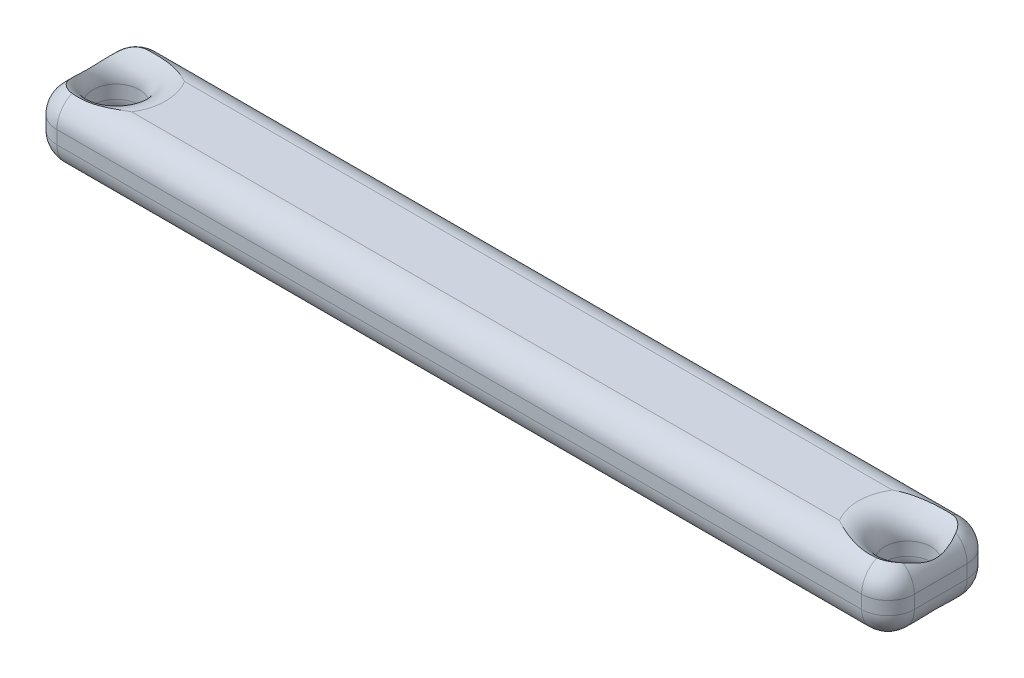
from build123d import *

# Parameters (mm, degrees)
SKETCH1_W           = 65
SKETCH1_H           = 5
BOSS_EXTRUDE1_DEPTH = 8
SKETCH2_R           = 1.75
CUT_EXTRUDE1_DEPTH  = 37.504037204
FILLET1_R           = 2


with BuildPart() as part:
    # Sketch1 → Boss-Extrude1 (new body)
    with BuildSketch(Plane.XY):
        with Locations((2.763929619, 0)):
            Rectangle(SKETCH1_W, SKETCH1_H)
    extrude(amount=-BOSS_EXTRUDE1_DEPTH)

    # Sketch2 → Cut-Extrude1 (cut, through all)
    with BuildSketch(Plane(origin=(0, 2.5, 0), x_dir=(1, 0, 0), z_dir=(0, 1, 0))):
        with Locations(Location((32.763929619, 4, 0), (0, 0, 180))):
            Circle(SKETCH2_R)
        with Locations((-27.236070381, 4)):
            Circle(SKETCH2_R)
    extrude(amount=-CUT_EXTRUDE1_DEPTH, mode=Mode.SUBTRACT)

    # Fillet1
    # the kernel refuses this fillet: 2 mm, written as the material it takes off along each edge
    with BuildSketch(Plane(origin=(33.263929619, 0.5, -6), x_dir=(0, 0, -1), z_dir=(0, 1, 0))) as fillet1_piece_1_section:
        Polygon((0, 0), (FILLET1_R, 0), (FILLET1_R, -FILLET1_R), (0, -FILLET1_R), align=None)
    fillet1_piece_1 = extrude(amount=FILLET1_R, mode=Mode.PRIVATE)
    fillet1_piece_1 = fillet1_piece_1 - Plane(origin=(33.263929619, 0.5, -6), x_dir=(-0.7071067811865475, 0, 0.7071067811865475), z_dir=(0, 1, 0)) * Sphere(FILLET1_R, mode=Mode.PRIVATE)
    add(fillet1_piece_1, mode=Mode.SUBTRACT)
    with BuildSketch(Plane(origin=(33.263929619, -0.5, -6), x_dir=(1, 0, 0), z_dir=(0, 0, -1))) as fillet1_piece_2_section:
        Polygon((0, 0), (FILLET1_R, 0), (FILLET1_R, FILLET1_R), (0, FILLET1_R), align=None)
    fillet1_piece_2 = extrude(amount=FILLET1_R, mode=Mode.PRIVATE)
    fillet1_piece_2 = fillet1_piece_2 - Plane(origin=(33.263929619, -0.5, -6), x_dir=(-0.7071067811865475, 0.7071067811865475, 0), z_dir=(0, 0, -1)) * Sphere(FILLET1_R, mode=Mode.PRIVATE)
    add(fillet1_piece_2, mode=Mode.SUBTRACT)
    with BuildSketch(Plane(origin=(-27.736070381, 0.5, -6), x_dir=(-1, 0, 0), z_dir=(0, 1, 0))) as fillet1_piece_3_section:
        Polygon((0, 0), (FILLET1_R, 0), (FILLET1_R, -FILLET1_R), (0, -FILLET1_R), align=None)
    fillet1_piece_3 = extrude(amount=FILLET1_R, mode=Mode.PRIVATE)
    fillet1_piece_3 = fillet1_piece_3 - Plane(origin=(-27.736070381, 0.5, -6), x_dir=(0.7071067811865475, 0, 0.7071067811865475), z_dir=(0, 1, 0)) * Sphere(FILLET1_R, mode=Mode.PRIVATE)
    add(fillet1_piece_3, mode=Mode.SUBTRACT)
    with BuildSketch(Plane(origin=(-27.736070381, -0.5, -6), x_dir=(0, 0, -1), z_dir=(-1, 0, 0))) as fillet1_piece_4_section:
        Polygon((0, 0), (FILLET1_R, 0), (FILLET1_R, FILLET1_R), (0, FILLET1_R), align=None)
    fillet1_piece_4 = extrude(amount=FILLET1_R, mode=Mode.PRIVATE)
    fillet1_piece_4 = fillet1_piece_4 - Plane(origin=(-27.736070381, -0.5, -6), x_dir=(0, 0.7071067811865475, 0.7071067811865475), z_dir=(-1, 0, 0)) * Sphere(FILLET1_R, mode=Mode.PRIVATE)
    add(fillet1_piece_4, mode=Mode.SUBTRACT)
    with BuildSketch(Plane(origin=(-27.736070381, 0.5, -2), x_dir=(-1, 0, 0), z_dir=(0, 1, 0))) as fillet1_piece_5_section:
        Polygon((0, 0), (FILLET1_R, 0), (FILLET1_R, FILLET1_R), (0, FILLET1_R), align=None)
    fillet1_piece_5 = extrude(amount=FILLET1_R, mode=Mode.PRIVATE)
    fillet1_piece_5 = fillet1_piece_5 - Plane(origin=(-27.736070381, 0.5, -2), x_dir=(0.7071067811865475, 0, -0.7071067811865475), z_dir=(0, 1, 0)) * Sphere(FILLET1_R, mode=Mode.PRIVATE)
    add(fillet1_piece_5, mode=Mode.SUBTRACT)
    with BuildSketch(Plane(origin=(33.263929619, 0.5, -2), x_dir=(0, 0, 1), z_dir=(0, 1, 0))) as fillet1_piece_6_section:
        Polygon((0, 0), (FILLET1_R, 0), (FILLET1_R, FILLET1_R), (0, FILLET1_R), align=None)
    fillet1_piece_6 = extrude(amount=FILLET1_R, mode=Mode.PRIVATE)
    fillet1_piece_6 = fillet1_piece_6 - Plane(origin=(33.263929619, 0.5, -2), x_dir=(-0.7071067811865475, 0, -0.7071067811865475), z_dir=(0, 1, 0)) * Sphere(FILLET1_R, mode=Mode.PRIVATE)
    add(fillet1_piece_6, mode=Mode.SUBTRACT)
    with BuildSketch(Plane(origin=(33.263929619, -0.5, -2), x_dir=(1, 0, 0), z_dir=(0, 0, 1))) as fillet1_piece_7_section:
        Polygon((0, 0), (FILLET1_R, 0), (FILLET1_R, -FILLET1_R), (0, -FILLET1_R), align=None)
    fillet1_piece_7 = extrude(amount=FILLET1_R, mode=Mode.PRIVATE)
    fillet1_piece_7 = fillet1_piece_7 - Plane(origin=(33.263929619, -0.5, -2), x_dir=(-0.7071067811865475, 0.7071067811865475, 0), z_dir=(0, 0, 1)) * Sphere(FILLET1_R, mode=Mode.PRIVATE)
    add(fillet1_piece_7, mode=Mode.SUBTRACT)
    with BuildSketch(Plane(origin=(-27.736070381, -0.5, -2), x_dir=(0, 0, 1), z_dir=(-1, 0, 0))) as fillet1_piece_8_section:
        Polygon((0, 0), (FILLET1_R, 0), (FILLET1_R, -FILLET1_R), (0, -FILLET1_R), align=None)
    fillet1_piece_8 = extrude(amount=FILLET1_R, mode=Mode.PRIVATE)
    fillet1_piece_8 = fillet1_piece_8 - Plane(origin=(-27.736070381, -0.5, -2), x_dir=(0, 0.7071067811865475, -0.7071067811865475), z_dir=(-1, 0, 0)) * Sphere(FILLET1_R, mode=Mode.PRIVATE)
    add(fillet1_piece_8, mode=Mode.SUBTRACT)
    with BuildSketch(Plane(origin=(35.263929619, 0.5, -8), x_dir=(-1, 0, 0), z_dir=(0, -1, 0)), Plane(origin=(-29.736070381, -0.5, 0), x_dir=(0, 0, -1), z_dir=(0, 1, 0))) as fillet1_piece_9:
        with BuildLine():
            CenterArc((FILLET1_R, -FILLET1_R), FILLET1_R, 90, 90)
            Line((0, -FILLET1_R), (0, 0))
            Line((0, 0), (FILLET1_R, 0))
        make_face()
    extrude(amount=1, mode=Mode.SUBTRACT)
    with BuildSketch(Plane(origin=(-27.736070381, 2.5, -8), x_dir=(0, 0, 1), z_dir=(1, 0, 0)), Plane(origin=(33.263929619, -2.5, 0), x_dir=(0, 1, 0), z_dir=(-1, 0, 0))) as fillet1_piece_10:
        with BuildLine():
            CenterArc((FILLET1_R, FILLET1_R), FILLET1_R, 180, 90)
            Line((0, FILLET1_R), (0, 0))
            Line((0, 0), (FILLET1_R, 0))
        make_face()
    extrude(amount=61, mode=Mode.SUBTRACT)
    with BuildSketch(Plane(origin=(-27.236070381, 2.5, -4), x_dir=(1, 0, 0), z_dir=(0, 0, 1))) as fillet1_piece_11:
        with BuildLine():
            CenterArc((1.75 + FILLET1_R, -FILLET1_R), FILLET1_R, 90, 90)
            Line((1.75, -FILLET1_R), (1.75, 0))
            Line((1.75, 0), (1.75 + FILLET1_R, 0))
        make_face()
    revolve(axis=Axis((-27.236070381, 2.5, -4), (0, 1, 0)), mode=Mode.SUBTRACT)
    with BuildSketch(Plane(origin=(-27.236070381, -2.5, -4), x_dir=(1, 0, 0), z_dir=(0, 0, 1))) as fillet1_piece_12:
        with BuildLine():
            CenterArc((1.75 + FILLET1_R, FILLET1_R), FILLET1_R, 180, 90)
            Line((1.75 + FILLET1_R, 0), (1.75, 0))
            Line((1.75, 0), (1.75, FILLET1_R))
        make_face()
    revolve(axis=Axis((-27.236070381, -2.5, -4), (0, 1, 0)), mode=Mode.SUBTRACT)
    with BuildSketch(Plane(origin=(32.763929619, -2.5, -4), x_dir=(-1, 0, 0), z_dir=(0, 0, -1))) as fillet1_piece_13:
        with BuildLine():
            CenterArc((1.75 + FILLET1_R, FILLET1_R), FILLET1_R, 180, 90)
            Line((1.75 + FILLET1_R, 0), (1.75, 0))
            Line((1.75, 0), (1.75, FILLET1_R))
        make_face()
    revolve(axis=Axis((32.763929619, -2.5, -4), (0, 1, 0)), mode=Mode.SUBTRACT)
    with BuildSketch(Plane(origin=(32.763929619, 2.5, -4), x_dir=(-1, 0, 0), z_dir=(0, 0, -1))) as fillet1_piece_14:
        with BuildLine():
            CenterArc((1.75 + FILLET1_R, -FILLET1_R), FILLET1_R, 90, 90)
            Line((1.75, -FILLET1_R), (1.75, 0))
            Line((1.75, 0), (1.75 + FILLET1_R, 0))
        make_face()
    revolve(axis=Axis((32.763929619, 2.5, -4), (0, 1, 0)), mode=Mode.SUBTRACT)
    with BuildSketch(Plane(origin=(-29.736070381, -0.5, -8), x_dir=(0, 0, 1), z_dir=(0, 1, 0)), Plane(origin=(35.263929619, 0.5, 0), x_dir=(-1, 0, 0), z_dir=(0, -1, 0))) as fillet1_piece_15:
        with BuildLine():
            CenterArc((FILLET1_R, FILLET1_R), FILLET1_R, 180, 90)
            Line((0, FILLET1_R), (0, 0))
            Line((0, 0), (FILLET1_R, 0))
        make_face()
    extrude(amount=1, mode=Mode.SUBTRACT)
    with BuildSketch(Plane(origin=(-27.736070381, 2.5, 0), x_dir=(0, 0, -1), z_dir=(1, 0, 0)), Plane(origin=(33.263929619, -2.5, -8), x_dir=(0, 1, 0), z_dir=(-1, 0, 0))) as fillet1_piece_16:
        with BuildLine():
            CenterArc((FILLET1_R, -FILLET1_R), FILLET1_R, 90, 90)
            Line((0, -FILLET1_R), (0, 0))
            Line((0, 0), (FILLET1_R, 0))
        make_face()
    extrude(amount=61, mode=Mode.SUBTRACT)
    with BuildSketch(Plane(origin=(-29.736070381, 2.5, -2), x_dir=(1, 0, 0), z_dir=(0, 0, -1)), Plane(origin=(-29.736070381, -2.5, -2), x_dir=(0, 1, 0), z_dir=(0, 0, -1))) as fillet1_piece_17:
        with BuildLine():
            CenterArc((FILLET1_R, FILLET1_R), FILLET1_R, 180, 90)
            Line((0, FILLET1_R), (0, 0))
            Line((0, 0), (FILLET1_R, 0))
        make_face()
    extrude(amount=4, mode=Mode.SUBTRACT)
    with BuildSketch(Plane(origin=(35.263929619, 2.5, -2), x_dir=(-1, 0, 0), z_dir=(0, 0, -1)), Plane(origin=(35.263929619, -2.5, -2), x_dir=(0, 1, 0), z_dir=(0, 0, -1))) as fillet1_piece_18:
        with BuildLine():
            CenterArc((FILLET1_R, -FILLET1_R), FILLET1_R, 90, 90)
            Line((0, -FILLET1_R), (0, 0))
            Line((0, 0), (FILLET1_R, 0))
        make_face()
    extrude(amount=4, mode=Mode.SUBTRACT)


solid = part.part
